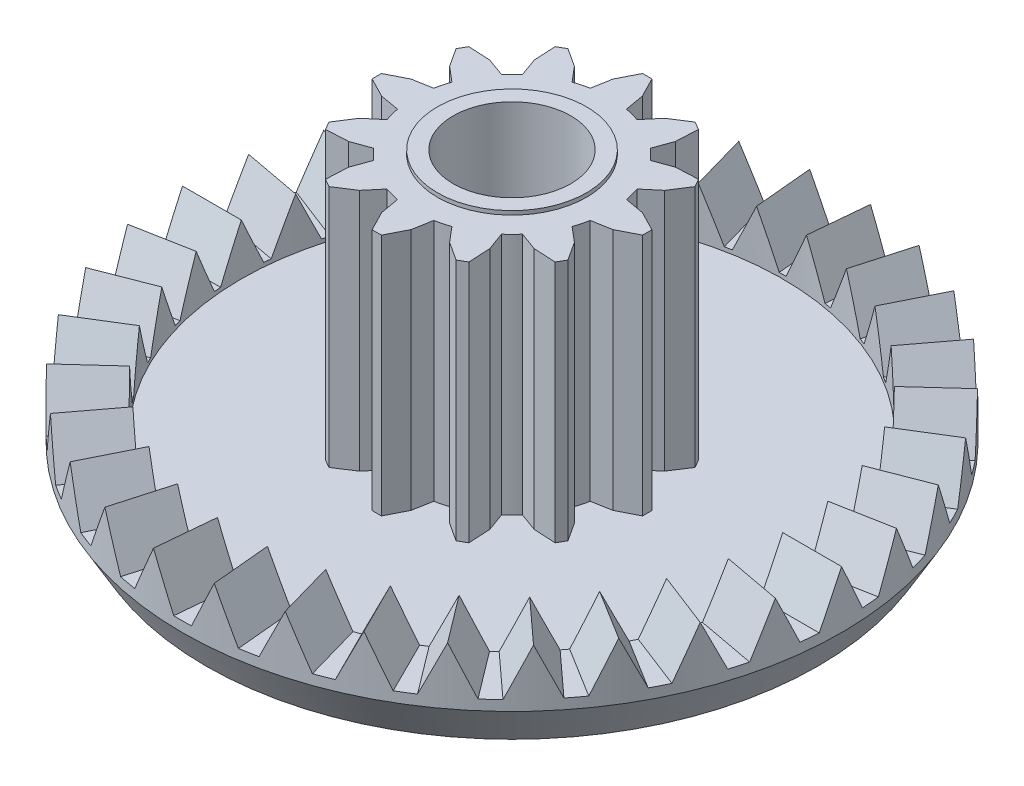
from build123d import *
from build123d.topology import SkipClean

# Parameters (mm, degrees)
SKETCH1_R              = 8.4
BOSS_EXTRUDE1_DEPTH    = 1.2
SKETCH2_R              = 4.15
CUT_EXTRUDE1_DEPTH     = 0.4
CUT_EXTRUDE1_DRAFT     = -45
CHAMFER1_SIZE          = 0.6
CHAMFER1_SIZE2         = 1.039230485
SKETCH4_R              = 8.4
SKETCH4_R_2            = 6.9
BOSS_EXTRUDE2_DEPTH    = 0.1
BOSS_EXTRUDE3_START    = 6.5
BOSS_EXTRUDE3_DEPTH    = 2
CIRPATTERN1_COUNT      = 34
CUT_EXTRUDE3_OUTLINE_W = 0.117775531
CUT_EXTRUDE3_OUTLINE_H = 1.2
SKETCH6_R              = 2.5
BOSS_EXTRUDE4_DEPTH    = 6.2
BOSS_EXTRUDE5_DEPTH    = 6.2
CIRPATTERN2_COUNT      = 12
SKETCH8_R              = 1.9
SKETCH8_R_2            = 1.5
BOSS_EXTRUDE6_DEPTH    = 0.1
CUT_EXTRUDE4_START     = -7
SKETCH9_R              = 1.5
CUT_EXTRUDE4_DEPTH     = 7


# Read off the part's stored shape, not the designer's step: Cut-Extrude3
with BuildPart() as part:
    # Sketch1 → Boss-Extrude1 (new body)
    with BuildSketch(Plane(origin=(0, 0, 0), x_dir=(1, 0, 0), z_dir=(0, 1, 0))):
        with Locations(Location((0, 0, 0), (0, 0, 270))):
            Circle(SKETCH1_R)
    extrude(amount=BOSS_EXTRUDE1_DEPTH)


with BuildPart() as cut_extrude1_tool:
    # Sketch2 → Cut-Extrude1 (with draft: the straight prism first)
    with BuildSketch(Plane.XZ):
        Circle(SKETCH2_R)
    extrude(amount=-CUT_EXTRUDE1_DEPTH)
    # Cut-Extrude1: the draft: its side faces are tilted about the plane it starts from
    cut_extrude1_sides = [cut_extrude1_tool.faces().sort_by_distance(p)[0] for p in [
        (-4.15, 0.2, 0),
    ]]
    draft(cut_extrude1_sides, Plane.XZ, CUT_EXTRUDE1_DRAFT)


with BuildPart() as part_1:
    add(part.part)

    # Cut-Extrude1: cut by cut_extrude1_tool
    add(cut_extrude1_tool.part, mode=Mode.SUBTRACT)

    # Chamfer1
    chamfer1_edges = [part_1.edges().sort_by_distance(p)[0] for p in [
        (0, 0, -8.4),
    ]]
    chamfer1_side = [part_1.faces().sort_by_distance(p)[0] for p in [
        (0, 0, -8.162412122),
    ]]
    chamfer(chamfer1_edges, length=CHAMFER1_SIZE, length2=CHAMFER1_SIZE2, reference=chamfer1_side[0])

    # Sketch4 → Boss-Extrude2 (add)
    with BuildSketch(Plane(origin=(0, 1.2, 0), x_dir=(1, 0, 0), z_dir=(0, 1, 0))):
        with Locations(Location((0, 0, 0), (0, 0, 270))):
            Circle(SKETCH4_R)
        with Locations(Location((0, 0, 0), (0, 0, 270))):
            Circle(SKETCH4_R_2, mode=Mode.SUBTRACT)
    extrude(amount=BOSS_EXTRUDE2_DEPTH)

    # Sketch3 → Boss-Extrude3 (add)
    with BuildSketch(Plane(origin=(0, 0, 0), x_dir=(0, 0, -1), z_dir=(1, 0, 0)).offset(BOSS_EXTRUDE3_START)):
        Polygon((-0.55, 1.3), (0, 2.5), (0.55, 1.3), align=None)
    boss_extrude3 = extrude(amount=BOSS_EXTRUDE3_DEPTH)

    # CirPattern1: Boss-Extrude3 ×34 about axis
    cirpattern1_axis = Axis((0, 0, 0), (0, 1, 0))
    for i in range(1, CIRPATTERN1_COUNT):
        add(boss_extrude3.rotate(cirpattern1_axis, i * 360 / CIRPATTERN1_COUNT))

    # Cut-Extrude3 outline → Cut-Extrude3 (revolve, cut)
    with SkipClean():  # the faces are left unmerged after this step: merging them gives an invalid solid
        with BuildSketch(Plane.XY):
            with Locations((8.458887766, 1.9)):
                Rectangle(CUT_EXTRUDE3_OUTLINE_W, CUT_EXTRUDE3_OUTLINE_H)
            Polygon((6.9, 1.3), (6.9, 2.5), (0, 2.5), (0, 1.2), (6.9, 1.2), align=None)
        revolve(axis=Axis((0, 0, 0), (0, 1, 0)), mode=Mode.SUBTRACT)
    add(part_1.part.scale(1), mode=Mode.REPLACE)  # the faces are merged on a copy

    # Sketch6 → Boss-Extrude4 (add)
    with BuildSketch(Plane(origin=(0, 1.2, 0), x_dir=(1, 0, 0), z_dir=(0, 1, 0))):
        with Locations(Location((0, 0, 0), (0, 0, 270))):
            Circle(SKETCH6_R)
    extrude(amount=BOSS_EXTRUDE4_DEPTH)

    # Sketch7 → Boss-Extrude5 (add)
    with BuildSketch(Plane(origin=(0, 1.2, 0), x_dir=(1, 0, 0), z_dir=(0, 1, 0))):
        Polygon((-0.462187812, 2.45690505), (0.462187812, 2.45690505), (0.375, 2.94690505), (0.119218039, 3.447939538), (-0.119218039, 3.447939538), (-0.375, 2.94690505), align=None)
    boss_extrude5 = extrude(amount=BOSS_EXTRUDE5_DEPTH)

    # CirPattern2: Boss-Extrude5 ×12 about axis
    cirpattern2_axis = Axis((0, 0, 0), (0, 1, 0))
    for i in range(1, CIRPATTERN2_COUNT):
        add(boss_extrude5.rotate(cirpattern2_axis, i * 360 / CIRPATTERN2_COUNT))

    # Sketch8 → Boss-Extrude6 (add)
    with BuildSketch(Plane(origin=(0, 7.4, 0), x_dir=(1, 0, 0), z_dir=(0, 1, 0))):
        with Locations(Location((0, 0, 0), (0, 0, 270))):
            Circle(SKETCH8_R)
        with Locations(Location((0, 0, 0), (0, 0, 270))):
            Circle(SKETCH8_R_2, mode=Mode.SUBTRACT)
    extrude(amount=BOSS_EXTRUDE6_DEPTH)

    # Sketch9 → Cut-Extrude4 (cut)
    with BuildSketch(Plane(origin=(0, 7.4, 0), x_dir=(1, 0, 0), z_dir=(0, 1, 0)).offset(CUT_EXTRUDE4_START)):
        with Locations(Location((0, 0, 0), (0, 0, 90))):
            Circle(SKETCH9_R)
    extrude(amount=CUT_EXTRUDE4_DEPTH, mode=Mode.SUBTRACT)


solid = part_1.part
